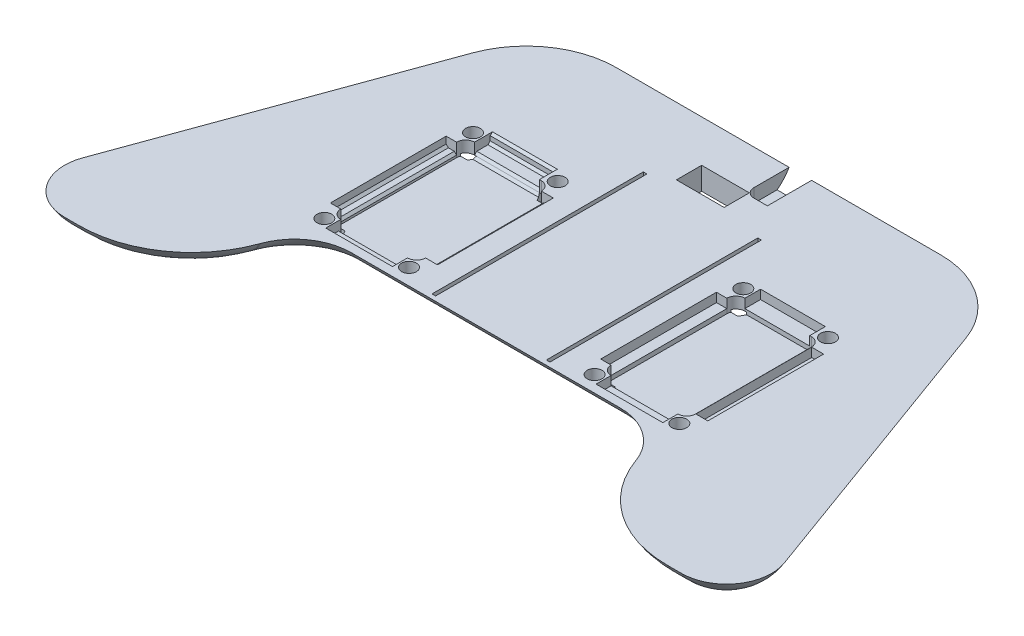
from build123d import *

# Parameters (mm, degrees)
EXTRUDE_1_DEPTH        = 5
FILLET_1_R             = 10
SKETCH_3_R             = 1.65
SKETCH_3_W             = 9.6
SKETCH_3_H             = 4.6
CUT_EXTRUDE_1_DEPTH    = 103.021848759
CUT_EXTRUDE_4_DEPTH    = 3
SKETCH_5_W             = 0.8
SKETCH_5_H             = 46.92
CUT_EXTRUDE_5_DEPTH    = 103.021848759
SKETCH_6_W             = 2.5
SKETCH_6_H             = 46.93052899
CUT_EXTRUDE_6_DEPTH    = 2
CUT_EXTRUDE_7_DEPTH    = 2.5
SKETCH_8_W             = 10.6
SKETCH_8_H             = 5.6
CUT_EXTRUDE_8_DEPTH    = 103.021848759
SKETCH_9_W             = 2.306802409
SKETCH_9_H             = 25.700068816
SKETCH_9_W_2           = 14.389350395
SKETCH_9_H_2           = 3.477408743
SKETCH_9_W_3           = 2.663174638
SKETCH_9_W_4           = 14.81506942
SKETCH_9_H_3           = 3.329803064
CUT_EXTRUDE_9_DEPTH    = 2
CHAMFER_1_SIZE         = 0.5
PATTERN_LINEAR_3_COUNT = 2
PATTERN_LINEAR_3_PITCH = 60


# Some blends are built 0.0001 mm under size
with BuildPart() as part:
    # 草图1 → 凸台-拉伸1 (new body)
    with BuildSketch(Plane(origin=(0, 0, 0), x_dir=(1, 0, 0), z_dir=(0, 1, 0))):
        with BuildLine():
            Line((-29.836138674, 0), (0, 0))
            Line((0, 0), (0, 65))
            Line((0, 65), (-35.995849236, 65))
            ThreePointArc((-35.995849236, 65), (-47.467377963, 61.383040886), (-54.789701652, 51.840402867))
            Line((-54.789701652, 51.840402867), (-77.872767224, -11.579798567))
            ThreePointArc((-77.872767224, -11.579798567), (-76.667361459, -20.735764364), (-68.475841017, -25))
            Line((-68.475841017, -25), (-65.262509539, -25))
            ThreePointArc((-65.262509539, -25), (-50.92309863, -20.478801107), (-41.77019402, -8.550503583))
            Line((-41.77019402, -8.550503583), (-41.675341812, -8.289899283))
            ThreePointArc((-41.675341812, -8.289899283), (-37.062637845, -2.278506436), (-29.836138674, 0))
        make_face()
        with BuildLine():
            Line((0, 65), (0, 0))
            Line((0, 0), (29.836138674, 0))
            ThreePointArc((29.836138674, 0), (37.062637845, -2.278506436), (41.675341812, -8.289899283))
            Line((41.675341812, -8.289899283), (41.77019402, -8.550503583))
            ThreePointArc((41.77019402, -8.550503583), (50.92309863, -20.478801107), (65.262509539, -25))
            Line((65.262509539, -25), (68.475841017, -25))
            ThreePointArc((68.475841017, -25), (76.667361459, -20.735764364), (77.872767224, -11.579798567))
            Line((77.872767224, -11.579798567), (54.789701652, 51.840402867))
            ThreePointArc((54.789701652, 51.840402867), (47.467377963, 61.383040886), (35.995849236, 65))
            Line((35.995849236, 65), (0, 65))
        make_face()
    extrude(amount=EXTRUDE_1_DEPTH)

    # 圆角1
    # the kernel refuses this fillet: 10 mm, written as the material it takes off along each edge
    with BuildSketch(Plane(origin=(-65.262509539, 0, 0), x_dir=(0, 0, 1), z_dir=(-1, 0, 0))) as fillet_1_piece_1:
        with BuildLine():
            CenterArc((16.339745962, 10), FILLET_1_R, 270, 60)
            Line((25, 5), (25.173205081, 4.9))
            ThreePointArc((25.173205081, 4.9), (25.2, 2.5), (25.2, 0))
            Line((25.2, 0), (25, -0.2))
            Line((25, -0.2), (16.339745962, -0.2))
            Line((16.339745962, -0.2), (16.339745962, 0))
        make_face()
    revolve(axis=Axis((-65.262509539, 0, 0), (0, 1, 0)), revolution_arc=70, mode=Mode.SUBTRACT)
    with BuildSketch(Plane(origin=(-41.77019402, 0, 8.550503583), x_dir=(-0.9396926207858984, 0, -0.342020143325696), z_dir=(0.342020143325696, 0, -0.9396926207858985)), Plane(origin=(41.675341812, 0, 8.289899283), x_dir=(0.939692620785891, 0, -0.34202014332571656), z_dir=(0.34202014332571656, 0, 0.939692620785891))) as fillet_1_piece_2:
        with BuildLine():
            CenterArc((8.660254038, 10), FILLET_1_R, 210, 60)
            Line((0, 5), (-0.173205081, 4.9))
            ThreePointArc((-0.173205081, 4.9), (-0.2, 2.5), (-0.2, 0))
            Line((-0.2, 0), (0, -0.2))
            Line((0, -0.2), (8.660254038, -0.2))
            Line((8.660254038, -0.2), (8.660254038, 0))
        make_face()
    extrude(amount=0.277329303, mode=Mode.SUBTRACT)
    with BuildSketch(Plane(origin=(-29.836138674, 0, 12.599016823), x_dir=(-0.9396926207859091, 0, -0.3420201433256668), z_dir=(-0.3420201433256668, 0, 0.9396926207859091))) as fillet_1_piece_3:
        with BuildLine():
            CenterArc((21.259270861, -10), FILLET_1_R, 90, 60)
            Line((12.599016823, -5), (12.425811742, -4.9))
            ThreePointArc((12.425811742, -4.9), (12.399016823, -2.5), (12.399016823, 0))
            Line((12.399016823, 0), (12.599016823, 0.2))
            Line((12.599016823, 0.2), (21.259270861, 0.2))
            Line((21.259270861, 0.2), (21.259270861, 0))
        make_face()
    revolve(axis=Axis((-29.836138674, 0, 12.599016823), (0, -1, 0)), revolution_arc=70, mode=Mode.SUBTRACT)
    with BuildSketch(Plane(origin=(-29.836138674, 0, 0), x_dir=(0, 1, 0), z_dir=(1, 0, 0))) as fillet_1_piece_4:
        with BuildLine():
            CenterArc((10, -8.660254038), FILLET_1_R, 120, 60)
            Line((0, -8.660254038), (-0.2, -8.660254038))
            Line((-0.2, -8.660254038), (-0.2, 0))
            Line((-0.2, 0), (0, 0.2))
            ThreePointArc((0, 0.2), (2.5, 0.2), (4.9, 0.173205081))
            Line((4.9, 0.173205081), (5, 0))
        make_face()
    extrude(amount=59.672277348, mode=Mode.SUBTRACT)
    with BuildSketch(Plane(origin=(29.836138674, 0, 12.599016823), x_dir=(0, 0, -1), z_dir=(-1, 0, 0))) as fillet_1_piece_5:
        with BuildLine():
            CenterArc((21.259270861, -10), FILLET_1_R, 90, 60)
            Line((12.599016823, -5), (12.425811742, -4.9))
            ThreePointArc((12.425811742, -4.9), (12.399016823, -2.5), (12.399016823, 0))
            Line((12.399016823, 0), (12.599016823, 0.2))
            Line((12.599016823, 0.2), (21.259270861, 0.2))
            Line((21.259270861, 0.2), (21.259270861, 0))
        make_face()
    revolve(axis=Axis((29.836138674, 0, 12.599016823), (0, -1, 0)), revolution_arc=70, mode=Mode.SUBTRACT)
    with BuildSketch(Plane(origin=(65.262509539, 0, 0), x_dir=(-0.9396926207859095, 0, 0.34202014332566577), z_dir=(-0.34202014332566577, 0, -0.9396926207859095))) as fillet_1_piece_6:
        with BuildLine():
            CenterArc((16.339745962, 10), FILLET_1_R, 270, 60)
            Line((25, 5), (25.173205081, 4.9))
            ThreePointArc((25.173205081, 4.9), (25.2, 2.5), (25.2, 0))
            Line((25.2, 0), (25, -0.2))
            Line((25, -0.2), (16.339745962, -0.2))
            Line((16.339745962, -0.2), (16.339745962, 0))
        make_face()
    revolve(axis=Axis((65.262509539, 0, 0), (0, 1, 0)), revolution_arc=70, mode=Mode.SUBTRACT)
    with BuildSketch(Plane(origin=(65.262509539, 0, 25), x_dir=(0, 0, -1), z_dir=(1, 0, 0)), Plane(origin=(-68.475841017, 0, 25), x_dir=(0, 0, -1), z_dir=(1, 0, 0))) as fillet_1_piece_7:
        with BuildLine():
            CenterArc((8.660254038, 10), FILLET_1_R, 210, 60)
            Line((0, 5), (-0.173205081, 4.9))
            ThreePointArc((-0.173205081, 4.9), (-0.2, 2.5), (-0.2, 0))
            Line((-0.2, 0), (0, -0.2))
            Line((0, -0.2), (8.660254038, -0.2))
            Line((8.660254038, -0.2), (8.660254038, 0))
        make_face()
    extrude(amount=3.213331477, mode=Mode.SUBTRACT)
    with BuildSketch(Plane(origin=(68.475841017, 0, 15), x_dir=(0, 0, 1), z_dir=(-1, 0, 0))) as fillet_1_piece_8:
        with BuildLine():
            CenterArc((1.339745962, 10), FILLET_1_R, 270, 60)
            Line((10, 5), (10.173205081, 4.9))
            ThreePointArc((10.173205081, 4.9), (10.2, 2.5), (10.2, 0))
            Line((10.2, 0), (10, -0.2))
            Line((10, -0.2), (1.339745962, -0.2))
            Line((1.339745962, -0.2), (1.339745962, 0))
        make_face()
    revolve(axis=Axis((68.475841017, 0, 15), (0, 1, 0)), revolution_arc=110, mode=Mode.SUBTRACT)
    with BuildSketch(Plane(origin=(77.872767224, 0, 11.579798567), x_dir=(-0.9396926207859094, 0, 0.3420201433256662), z_dir=(-0.3420201433256662, 0, -0.9396926207859093)), Plane(origin=(-54.789701652, 0, -51.840402867), x_dir=(0.9396926207859094, 0, 0.3420201433256662), z_dir=(-0.3420201433256662, 0, 0.9396926207859093))) as fillet_1_piece_9:
        with BuildLine():
            CenterArc((8.660254038, 10), FILLET_1_R, 210, 60)
            Line((0, 5), (-0.173205081, 4.9))
            ThreePointArc((-0.173205081, 4.9), (-0.2, 2.5), (-0.2, 0))
            Line((-0.2, 0), (0, -0.2))
            Line((0, -0.2), (8.660254038, -0.2))
            Line((8.660254038, -0.2), (8.660254038, 0))
        make_face()
    extrude(amount=67.490368691, mode=Mode.SUBTRACT)
    with BuildSketch(Plane(origin=(35.995849236, 0, -45), x_dir=(0.9396926207859095, 0, -0.3420201433256653), z_dir=(0.3420201433256653, 0, 0.9396926207859095))) as fillet_1_piece_10:
        with BuildLine():
            CenterArc((11.339745962, 10), FILLET_1_R, 270, 60)
            Line((20, 5), (20.173205081, 4.9))
            ThreePointArc((20.173205081, 4.9), (20.2, 2.5), (20.2, 0))
            Line((20.2, 0), (20, -0.2))
            Line((20, -0.2), (11.339745962, -0.2))
            Line((11.339745962, -0.2), (11.339745962, 0))
        make_face()
    revolve(axis=Axis((35.995849236, 0, -45), (0, 1, 0)), revolution_arc=70, mode=Mode.SUBTRACT)
    with BuildSketch(Plane(origin=(-35.995849236, 0, -65), x_dir=(0, 0, 1), z_dir=(1, 0, 0))) as fillet_1_piece_11:
        with BuildLine():
            CenterArc((8.660254038, -10), FILLET_1_R, 90, 60)
            Line((0, -5), (-0.173205081, -4.9))
            ThreePointArc((-0.173205081, -4.9), (-0.2, -2.5), (-0.2, 0))
            Line((-0.2, 0), (0, 0.2))
            Line((0, 0.2), (8.660254038, 0.2))
            Line((8.660254038, 0.2), (8.660254038, 0))
        make_face()
    extrude(amount=71.991698472, mode=Mode.SUBTRACT)
    with BuildSketch(Plane(origin=(-35.995849236, 0, -45), x_dir=(0, 0, -1), z_dir=(1, 0, 0))) as fillet_1_piece_12:
        with BuildLine():
            CenterArc((11.339745962, 10), FILLET_1_R, 270, 60)
            Line((20, 5), (20.173205081, 4.9))
            ThreePointArc((20.173205081, 4.9), (20.2, 2.5), (20.2, 0))
            Line((20.2, 0), (20, -0.2))
            Line((20, -0.2), (11.339745962, -0.2))
            Line((11.339745962, -0.2), (11.339745962, 0))
        make_face()
    revolve(axis=Axis((-35.995849236, 0, -45), (0, 1, 0)), revolution_arc=70, mode=Mode.SUBTRACT)
    with BuildSketch(Plane(origin=(-68.475841017, 0, 15), x_dir=(-0.9396926207859095, 0, -0.34202014332566577), z_dir=(0.34202014332566577, 0, -0.9396926207859095))) as fillet_1_piece_13:
        with BuildLine():
            CenterArc((1.339745962, 10), FILLET_1_R, 270, 60)
            Line((10, 5), (10.173205081, 4.9))
            ThreePointArc((10.173205081, 4.9), (10.2, 2.5), (10.2, 0))
            Line((10.2, 0), (10, -0.2))
            Line((10, -0.2), (1.339745962, -0.2))
            Line((1.339745962, -0.2), (1.339745962, 0))
        make_face()
    revolve(axis=Axis((-68.475841017, 0, 15), (0, 1, 0)), revolution_arc=110, mode=Mode.SUBTRACT)

    # 草图3 → 切除-拉伸1 (cut, through all)
    with BuildSketch(Plane(origin=(0, 5, 0), x_dir=(1, 0, 0), z_dir=(0, 1, 0))):
        with Locations(Location((-39.4, 36.581306523, 0), (0, 0, 270))):
            Circle(SKETCH_3_R)
        with Locations(Location((-20.6, 36.581306523, 0), (0, 0, 270))):
            Circle(SKETCH_3_R)
        with Locations(Location((20.6, 36.581306523, 0), (0, 0, 270))):
            Circle(SKETCH_3_R)
        with Locations(Location((-39.4, 3.581306523, 0), (0, 0, 270))):
            Circle(SKETCH_3_R)
        with Locations(Location((-20.6, 3.581306523, 0), (0, 0, 270))):
            Circle(SKETCH_3_R)
        with Locations(Location((20.6, 3.581306523, 0), (0, 0, 270))):
            Circle(SKETCH_3_R)
        with Locations(Location((39.4, 36.581306523, 0), (0, 0, 270))):
            Circle(SKETCH_3_R)
        with Locations(Location((39.4, 3.581306523, 0), (0, 0, 270))):
            Circle(SKETCH_3_R)
        with Locations((-2.45, 52.881306523)):
            Rectangle(SKETCH_3_W, SKETCH_3_H)
    extrude(amount=-CUT_EXTRUDE_1_DEPTH, mode=Mode.SUBTRACT)

    # 草图4 → 切除-拉伸4 (cut)
    with BuildSketch(Plane(origin=(0, 5, 0), x_dir=(1, 0, 0), z_dir=(0, 1, 0))):
        with BuildLine():
            Line((4.35, 55.181306523), (7.35, 55.181306523))
            Line((7.35, 55.181306523), (7.35, 65))
            Line((7.35, 65), (2.35, 65))
            Line((2.35, 65), (2.35, 57.181306523))
            ThreePointArc((2.35, 57.181306523), (2.935786438, 55.767092961), (4.35, 55.181306523))
        make_face()
        with BuildLine():
            Line((-37.4, 34.931306523), (-22.58493058, 34.931306523))
            ThreePointArc((-22.58493058, 34.931306523), (-21.170717018, 34.345520085), (-20.58493058, 32.931306523))
            Line((-20.58493058, 32.931306523), (-20.58493058, 7.231237707))
            ThreePointArc((-20.58493058, 7.231237707), (-21.170717018, 5.817024145), (-22.58493058, 5.231237707))
            Line((-22.58493058, 5.231237707), (-37.4, 5.231237707))
            ThreePointArc((-37.4, 5.231237707), (-38.814213562, 5.817024145), (-39.4, 7.231237707))
            Line((-39.4, 7.231237707), (-39.4, 32.931306523))
            ThreePointArc((-39.4, 32.931306523), (-38.814213562, 34.345520085), (-37.4, 34.931306523))
        make_face()
        with BuildLine():
            Line((22.6, 34.931306523), (37.38493058, 34.931306523))
            ThreePointArc((37.38493058, 34.931306523), (38.799144143, 34.345520085), (39.38493058, 32.931306523))
            Line((39.38493058, 32.931306523), (39.38493058, 7.231237707))
            ThreePointArc((39.38493058, 7.231237707), (38.799144143, 5.817024145), (37.38493058, 5.231237707))
            Line((37.38493058, 5.231237707), (22.6, 5.231237707))
            ThreePointArc((22.6, 5.231237707), (21.185786438, 5.817024145), (20.6, 7.231237707))
            Line((20.6, 7.231237707), (20.6, 32.931306523))
            ThreePointArc((20.6, 32.931306523), (21.185786438, 34.345520085), (22.6, 34.931306523))
        make_face()
    extrude(amount=-CUT_EXTRUDE_4_DEPTH, mode=Mode.SUBTRACT)

    # 草图5 → 切除-拉伸5 (cut, through all)
    with BuildSketch(Plane(origin=(0, 5, 0), x_dir=(1, 0, 0), z_dir=(0, 1, 0))):
        with Locations((-12.55, 24.487847206)):
            Rectangle(SKETCH_5_W, SKETCH_5_H)
        with Locations((12.85, 24.487847206)):
            Rectangle(SKETCH_5_W, SKETCH_5_H)
    extrude(amount=-CUT_EXTRUDE_5_DEPTH, mode=Mode.SUBTRACT)

    # 草图6 → 切除-拉伸6 (cut)
    with BuildSketch(Plane.XZ):
        with Locations((-12.55, -24.482582711)):
            Rectangle(SKETCH_6_W, SKETCH_6_H)
        with Locations((12.85, -24.482582711)):
            Rectangle(SKETCH_6_W, SKETCH_6_H)
    extrude(amount=-CUT_EXTRUDE_6_DEPTH, mode=Mode.SUBTRACT)

    # 草图7 → 切除-拉伸7 (cut)
    with BuildSketch(Plane.XZ):
        Polygon((-17.251368439, -36.581306523), (-18.925684219, -33.681306523), (-22.274315781, -33.681306523), (-23.948631561, -36.581306523), (-22.274315781, -39.481306523), (-18.925684219, -39.481306523), align=None)
        Polygon((-36.051368439, -36.581306523), (-37.725684219, -33.681306523), (-41.074315781, -33.681306523), (-42.748631561, -36.581306523), (-41.074315781, -39.481306523), (-37.725684219, -39.481306523), align=None)
        Polygon((-17.251368439, -3.581306523), (-18.925684219, -0.681306523), (-22.274315781, -0.681306523), (-23.948631561, -3.581306523), (-22.274315781, -6.481306523), (-18.925684219, -6.481306523), align=None)
        Polygon((-36.051368439, -3.581306523), (-37.725684219, -0.681306523), (-41.074315781, -0.681306523), (-42.748631561, -3.581306523), (-41.074315781, -6.481306523), (-37.725684219, -6.481306523), align=None)
        Polygon((42.748631561, -36.581306523), (41.074315781, -33.681306523), (37.725684219, -33.681306523), (36.051368439, -36.581306523), (37.725684219, -39.481306523), (41.074315781, -39.481306523), align=None)
        Polygon((23.948631561, -36.581306523), (22.274315781, -33.681306523), (18.925684219, -33.681306523), (17.251368439, -36.581306523), (18.925684219, -39.481306523), (22.274315781, -39.481306523), align=None)
        Polygon((42.748631561, -3.581306523), (41.074315781, -0.681306523), (37.725684219, -0.681306523), (36.051368439, -3.581306523), (37.725684219, -6.481306523), (41.074315781, -6.481306523), align=None)
        Polygon((23.948631561, -3.581306523), (22.274315781, -0.681306523), (18.925684219, -0.681306523), (17.251368439, -3.581306523), (18.925684219, -6.481306523), (22.274315781, -6.481306523), align=None)
    extrude(amount=-CUT_EXTRUDE_7_DEPTH, mode=Mode.SUBTRACT)

    # 草图8 → 切除-拉伸8 (cut, through all)
    with BuildSketch(Plane(origin=(0, 5, 0), x_dir=(1, 0, 0), z_dir=(0, 1, 0))):
        with Locations((-2.45, 52.881306523)):
            Rectangle(SKETCH_8_W, SKETCH_8_H)
    extrude(amount=-CUT_EXTRUDE_8_DEPTH, mode=Mode.SUBTRACT)

    # 草图9 → 切除-拉伸9 (cut)
    with BuildSketch(Plane(origin=(0, 5, 0), x_dir=(1, 0, 0), z_dir=(0, 1, 0))):
        with Locations((-40.553401205, 20.081272115)):
            Rectangle(SKETCH_9_W, SKETCH_9_H)
        with Locations((-30.205324803, 36.670010895)):
            Rectangle(SKETCH_9_W_2, SKETCH_9_H_2)
        with Locations((-19.253343261, 20.081272115)):
            Rectangle(SKETCH_9_W_3, SKETCH_9_H)
        with Locations((-29.99246529, 3.566336175)):
            Rectangle(SKETCH_9_W_4, SKETCH_9_H_3)
    cut_extrude_9 = extrude(amount=-CUT_EXTRUDE_9_DEPTH, mode=Mode.SUBTRACT)

    # 倒角1
    chamfer_1_edges = [part.edges().sort_by_distance(p)[0] for p in [
        (-30, 2, -34.931306523),
        (-30, 2, -5.231237707),
        (-29.99246529, 3, -1.901434643),
        (-29.99246529, 3, -5.231237707),
        (-30.205324802, 5, -38.408715266),
        (-30.205324802, 3, -38.408715266),
        (-17.921755942, 3, -20.081272115),
        (-20.58493058, 3, -20.081272115),
        (-41.706802409, 3, -20.081272115),
        (-39.4, 3, -20.081272115),
        (-30.205324802, 3, -34.931306523),
    ]]
    chamfer(chamfer_1_edges, length=CHAMFER_1_SIZE - 0.0001)  # a hair under: the kernel refuses the full size

    # 阵列(线性)3: 切除-拉伸9 ×2
    with Locations(*[(i * PATTERN_LINEAR_3_PITCH, 0, 0) for i in range(1, PATTERN_LINEAR_3_COUNT)]):
        add(cut_extrude_9, mode=Mode.SUBTRACT)


solid = part.part
